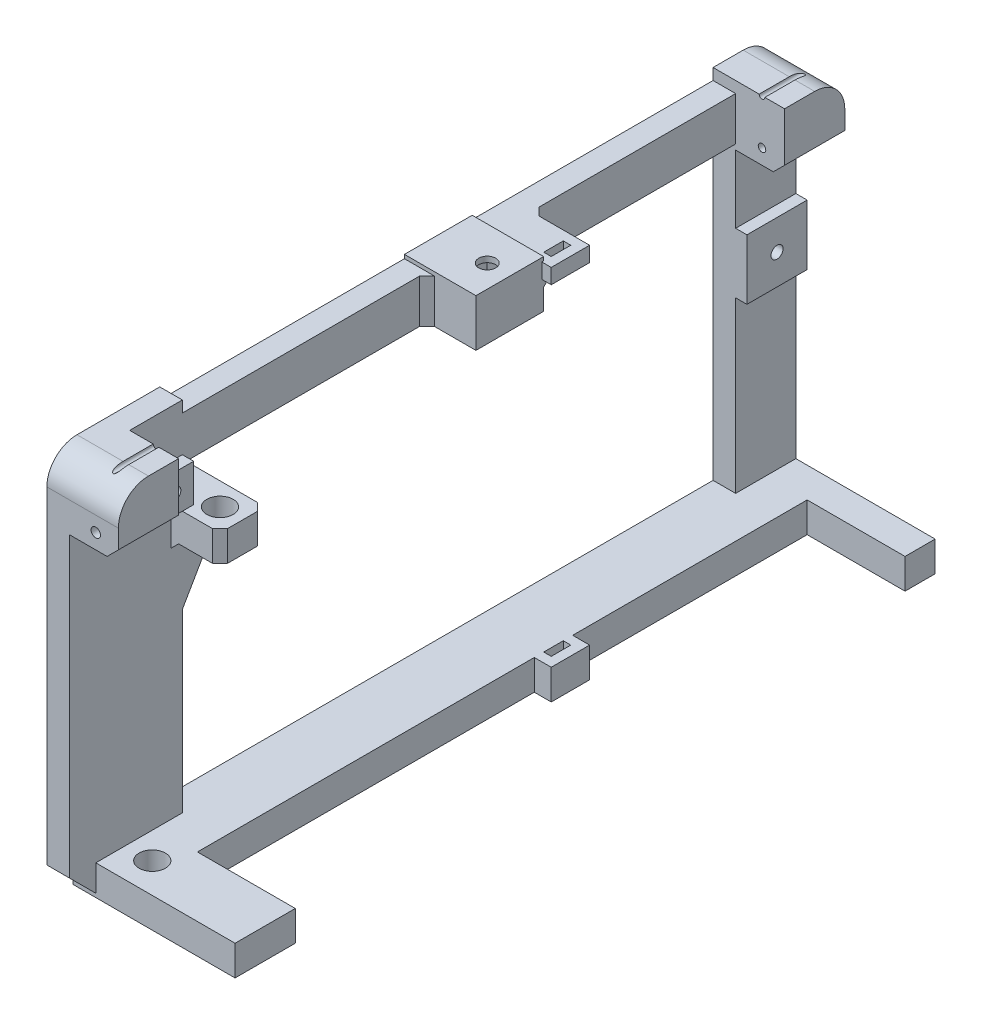
from build123d import *
from build123d.topology import SkipClean

# Parameters (mm, degrees)
BOSS_EXTRUDE1_DEPTH             = 4
SKETCH2_W                       = 8
SKETCH2_H                       = 8
BOSS_EXTRUDE2_DEPTH             = 26
BOSS_EXTRUDE3_DEPTH             = 7
BOSS_EXTRUDE4_DEPTH             = 6
BOSS_EXTRUDE6_DEPTH             = 3
BOSS_EXTRUDE7_DEPTH             = 3
F_7_0MM_DOWEL_HOLE1_D           = 7
SKETCH6_W                       = 1.6
SKETCH6_H                       = 6
SKETCH9_W                       = 1.6
SKETCH9_H                       = 37
M3_CLEARANCE_HOLE4_D            = 3.2
BOSS_EXTRUDE8_DEPTH             = 8
BOSS_EXTRUDE9_DEPTH             = 6
SKETCH15_W                      = 12
SKETCH15_H                      = 8
BOSS_EXTRUDE10_DEPTH            = 13
CHAMFER1_SIZE                   = 2
CUT_EXTRUDE1_REACH              = 199.606
SKETCH16_R                      = 3.5
CHAMFER2_SIZE                   = 2
BOSS_EXTRUDE11_START            = 13
BOSS_EXTRUDE11_DEPTH            = 13
CUT_EXTRUDE2_DEPTH              = 218.195764231
CUT_EXTRUDE2_DEPTH_BACK         = 218.195764231
SKETCH18_R                      = 0.75
TAP_DRILL_FOR_M3X0_5_TAP1_D     = 2.5
TAP_DRILL_FOR_M3X0_5_TAP1_DEPTH = 16
F_2_0MM_DOWEL_HOLE4_D           = 2
CHAMFER3_SIZE                   = 3
BOSS_EXTRUDE12_START            = -13
SKETCH24_W                      = 18
SKETCH24_H                      = 12.6
BOSS_EXTRUDE12_DEPTH            = 19
SKETCH25_W                      = 14
SKETCH25_H                      = 11.1
CUT_EXTRUDE3_DEPTH              = 5
CHAMFER4_SIZE                   = 2
SKETCH26_W                      = 2.25
SKETCH26_H                      = 1.5
SKETCH27_W                      = 15.5
SKETCH27_H                      = 10.2
SKETCH27_W_2                    = 2
SKETCH27_H_2                    = 5.2
BOSS_EXTRUDE13_DEPTH            = 4
CHAMFER5_SIZE                   = 2
CHAMFER6_SIZE                   = 7


with BuildPart() as part:
    # Sketch1 → Boss-Extrude1 (new body)
    with BuildSketch(Plane(origin=(0, 0, 0), x_dir=(0, 0, -1), z_dir=(1, 0, 0))):
        Polygon((0, 0), (-8, 0), (-8, -8), (178, -8), (178, 0), (170, 0), align=None)
    extrude(amount=BOSS_EXTRUDE1_DEPTH)

    # Sketch2 → Boss-Extrude2 (add)
    with BuildSketch(Plane(origin=(4, 0, 0), x_dir=(0, 0, -1), z_dir=(1, 0, 0))):
        Polygon((-8, -8), (0, -8), (8, -8), (8, 0), (0, 0), (-8, 0), align=None)
        with Locations((174, -4)):
            Rectangle(SKETCH2_W, SKETCH2_H)
    extrude(amount=BOSS_EXTRUDE2_DEPTH)

    # Sketch1<2> → Boss-Extrude3 (add)
    with BuildSketch(Plane(origin=(0, 0, 0), x_dir=(0, 0, -1), z_dir=(1, 0, 0))):
        Polygon((0, 0), (-8, 0), (-8, -8), (178, -8), (178, 0), (170, 0), align=None)
    extrude(amount=-BOSS_EXTRUDE3_DEPTH)

    # Sketch4 → Boss-Extrude4 (add)
    with BuildSketch(Plane.ZY.offset(7)):
        with BuildLine():
            Line((-178, 0), (-178, 87))
            ThreePointArc((-178, 87), (-175.656854249, 92.656854249), (-170, 95))
            Line((-170, 95), (-162, 95))
            Line((-162, 95), (-162, 92))
            Line((-162, 92), (-15, 92))
            Line((-15, 92), (-15, 95))
            Line((-15, 95), (2.4, 95))
            Line((2.4, 95), (7, 95))
            ThreePointArc((7, 95), (12.656854249, 92.656854249), (15, 87))
            Line((15, 87), (15, 77.4))
            Line((15, 77.4), (15, 2.4))
            Line((15, 2.4), (15, 0))
            Line((15, 0), (8, 0))
            Line((8, 0), (8, -8))
            Line((8, -8), (-178, -8))
            Line((-178, -8), (-178, 0))
        make_face()
        Polygon((-15, 2.4), (-15, 0), (-162, 0), (-162, 80.4), (-15, 80.4), (-15, 77.4), align=None, mode=Mode.SUBTRACT)
    extrude(amount=BOSS_EXTRUDE4_DEPTH)

    # Sketch10 → Boss-Extrude6 (add)
    with BuildSketch(Plane(origin=(-7, 0, 0), x_dir=(0, 0, -1), z_dir=(1, 0, 0))):
        Polygon((15, 82.4), (5, 82.4), (5, 72.4), (10, 72.4), (15, 72.4), (15, 77.4), align=None)
    extrude(amount=BOSS_EXTRUDE6_DEPTH)

    # Sketch10<3> → Boss-Extrude7 (add)
    with BuildSketch(Plane(origin=(-7, 0, 0), x_dir=(0, 0, -1), z_dir=(1, 0, 0))):
        Polygon((170, 61), (178, 61), (178, 53), (178, 45), (162, 45), (162, 61), align=None)
    extrude(amount=BOSS_EXTRUDE7_DEPTH)

    # Ø7.0mm Dowel Hole1 (through all)
    with Locations(Plane.ZX):
        with Locations((0, 0)):
            Hole(F_7_0MM_DOWEL_HOLE1_D / 2)

    # Sketch6 → M3 Clearance Hole2 (revolve, cut)
    with BuildSketch(Plane(origin=(-7, 53, -170), x_dir=(0, 0, -1), z_dir=(0, 1, 0))):
        with Locations((0.8, 3)):
            Rectangle(SKETCH6_W, SKETCH6_H)
    revolve(axis=Axis((-0.65, 53, -170), (-1, 0, 0)), mode=Mode.SUBTRACT)

    # Sketch9 → M3 Clearance Hole3 (revolve, cut)
    with BuildSketch(Plane(origin=(-7, 77.4, -10), x_dir=(0, 0, 1), z_dir=(0, 1, 0))):
        with Locations((0.8, 18.5)):
            Rectangle(SKETCH9_W, SKETCH9_H)
    revolve(axis=Axis((-13.35, 77.4, -10), (1, 0, 0)), mode=Mode.SUBTRACT)

    # M3 Clearance Hole4 (through all)
    with Locations(Plane(origin=(0, 0, 0), x_dir=(0, 0, -1), z_dir=(1, 0, 0))):
        with Locations((10, 77.4), (170, 53)):
            Hole(M3_CLEARANCE_HOLE4_D / 2)

    # Sketch13 → Boss-Extrude8 (add)
    with BuildSketch(Plane(origin=(0, 0, 0), x_dir=(1, 0, 0), z_dir=(0, 1, 0))):
        Polygon((6, 107.7), (8.5, 107.7), (8.5, 97.5), (6, 97.5), (4, 97.5), (4, 100), (6, 100), (6, 105.2), (4, 105.2), (4, 107.7), align=None)
    extrude(amount=-BOSS_EXTRUDE8_DEPTH)

    # Sketch14 → Boss-Extrude9 (add)
    with BuildSketch(Plane(origin=(-7, 0, 0), x_dir=(0, 0, -1), z_dir=(1, 0, 0))):
        Polygon((15, 72.4), (24, 72.4), (24, 62.4), (15, 46.811542732), align=None)
    extrude(amount=-BOSS_EXTRUDE9_DEPTH)

    # Sketch15 → Boss-Extrude10 (add)
    with BuildSketch(Plane(origin=(-7, 0, 0), x_dir=(0, 0, -1), z_dir=(1, 0, 0))):
        with Locations((18, 68.4)):
            Rectangle(SKETCH15_W, SKETCH15_H)
    extrude(amount=BOSS_EXTRUDE10_DEPTH)

    # Chamfer1
    chamfer1_edges = [part.edges().sort_by_distance(p)[0] for p in [
        (-7, 64.4, -18),
    ]]
    chamfer(chamfer1_edges, length=CHAMFER1_SIZE)

    # Sketch16 → Cut-Extrude1 (cut, up to next)
    with BuildSketch(Plane(origin=(0, 72.4, 0), x_dir=(1, 0, 0), z_dir=(0, 1, 0)), mode=Mode.PRIVATE) as cut_extrude1_sk1:
        with Locations(Location((0, 18, 0), (0, 0, 270))):
            Circle(SKETCH16_R)
    cut_extrude1_tool1 = extrude(cut_extrude1_sk1.sketch, amount=-CUT_EXTRUDE1_REACH, mode=Mode.PRIVATE) & part.part
    add(cut_extrude1_tool1.solids().sort_by_distance((0, 72.4, -18))[0], mode=Mode.SUBTRACT)

    # Chamfer2
    chamfer2_edges = [part.edges().sort_by_distance(p)[0] for p in [
        (6, 68.4, -24),
        (6, 68.4, -12),
    ]]
    chamfer(chamfer2_edges, length=CHAMFER2_SIZE)

    # Sketch17 → Boss-Extrude11 (add)
    with BuildSketch(Plane(origin=(-7, 0, 0), x_dir=(0, 0, -1), z_dir=(1, 0, 0)).offset(BOSS_EXTRUDE11_START)):
        with BuildLine():
            Line((1, 95), (1, 79))
            Line((1, 79), (-15, 79))
            Line((-15, 79), (-15, 87))
            ThreePointArc((-15, 87), (-12.656854249, 92.656854249), (-7, 95))
            Line((-7, 95), (1, 95))
        make_face()
        with BuildLine():
            Line((170, 95), (162, 95))
            Line((162, 95), (162, 79))
            Line((162, 79), (178, 79))
            Line((178, 79), (178, 87))
            ThreePointArc((178, 87), (175.656854249, 92.656854249), (170, 95))
        make_face()
    extrude(amount=-BOSS_EXTRUDE11_DEPTH)

    # Sketch18 → Cut-Extrude2 (cut, two sides: drawn at the far end of the back side and taken through both)
    with BuildSketch(Plane.XY.offset(15).offset(-CUT_EXTRUDE2_DEPTH_BACK)):
        with Locations((0, 95)):
            Circle(SKETCH18_R)
    extrude(amount=CUT_EXTRUDE2_DEPTH + CUT_EXTRUDE2_DEPTH_BACK, mode=Mode.SUBTRACT)

    # Tap Drill for M3x0.5 Tap1
    with Locations(Plane(origin=(0, 83, 15), x_dir=(0, 1, 0), z_dir=(0, 0, 1))):
        with Locations((0, 0)):
            Hole(TAP_DRILL_FOR_M3X0_5_TAP1_D / 2, depth=TAP_DRILL_FOR_M3X0_5_TAP1_DEPTH)

    # Ø2.0mm Dowel Hole4 (through all)
    with Locations(Plane(origin=(0, 83, 15), x_dir=(0, 1, 0), z_dir=(0, 0, 1))):
        with Locations((0, 0)):
            Hole(F_2_0MM_DOWEL_HOLE4_D / 2)

    # Chamfer3
    chamfer3_edges = [part.edges().sort_by_distance(p)[0] for p in [
        (6, 79, 7),
        (6, 79, -170),
    ]]
    chamfer(chamfer3_edges, length=CHAMFER3_SIZE)

    # Sketch24 → Boss-Extrude12 (add)
    with SkipClean():  # the faces are left unmerged after this step: merging them gives an invalid solid
        with BuildSketch(Plane(origin=(0, 0, 0), x_dir=(0, 0, -1), z_dir=(1, 0, 0)).offset(BOSS_EXTRUDE12_START)):
            with Locations((89, 86.7)):
                Rectangle(SKETCH24_W, SKETCH24_H)
        extrude(amount=BOSS_EXTRUDE12_DEPTH)

    # Sketch25 → Cut-Extrude3 (cut, symmetric)
    with SkipClean():  # the faces are left unmerged after this step: merging them gives an invalid solid
        with BuildSketch(Plane(origin=(0, 0, 0), x_dir=(0, 0, -1), z_dir=(1, 0, 0))):
            with Locations((89, 85.95)):
                Rectangle(SKETCH25_W, SKETCH25_H)
        extrude(amount=CUT_EXTRUDE3_DEPTH, both=True, mode=Mode.SUBTRACT)

    # Chamfer4
    chamfer4_edges = [part.edges().sort_by_distance(p)[0] for p in [
        (-7, 86.2, -80),
        (-7, 86.2, -98),
        (-5, 85.95, -82),
        (-5, 85.95, -96),
        (5, 85.95, -82),
        (5, 85.95, -96),
    ]]
    chamfer(chamfer4_edges, length=CHAMFER4_SIZE)

    # Sketch26 → Cut-Revolve1 (revolve, cut)
    with SkipClean():  # the faces are left unmerged after this step: merging them gives an invalid solid
        with BuildSketch(Plane(origin=(0, 0, 0), x_dir=(0, 0, -1), z_dir=(1, 0, 0)), mode=Mode.PRIVATE) as cut_revolve1_sk:
            with Locations((87.875, 92.25)):
                Rectangle(SKETCH26_W, SKETCH26_H)
        revolve(cut_revolve1_sk.sketch.rotate(Axis((0, 65.518758018, -89), (0, 1, 0)), 180), axis=Axis((0, 65.518758018, -89), (0, 1, 0)), mode=Mode.SUBTRACT)

    # Sketch27 → Boss-Extrude13 (add)
    with SkipClean():  # the faces are left unmerged after this step: merging them gives an invalid solid
        with BuildSketch(Plane(origin=(0, 92, 0), x_dir=(1, 0, 0), z_dir=(0, 1, 0))):
            with Locations((0.75, 102.6)):
                Rectangle(SKETCH27_W, SKETCH27_H)
            with Locations((5, 102.6)):
                Rectangle(SKETCH27_W_2, SKETCH27_H_2, mode=Mode.SUBTRACT)
        extrude(amount=-BOSS_EXTRUDE13_DEPTH)

    # Chamfer5
    chamfer5_edges = [part.edges().sort_by_distance(p)[0] for p in [
        (-6, 88, -99),
        (-7, 88, -103.85),
        (-7, 90, -107.7),
        (0.5, 88, -98),
    ]]
    chamfer(chamfer5_edges, length=CHAMFER5_SIZE - 0.0001)  # a hair under: the kernel refuses the full size

    # Chamfer6
    chamfer6_edges = [part.edges().sort_by_distance(p)[0] for p in [
        (-10, 0, 8),
    ]]
    chamfer(chamfer6_edges, length=CHAMFER6_SIZE - 0.0001)  # a hair under: the kernel refuses the full size


solid = part.part
